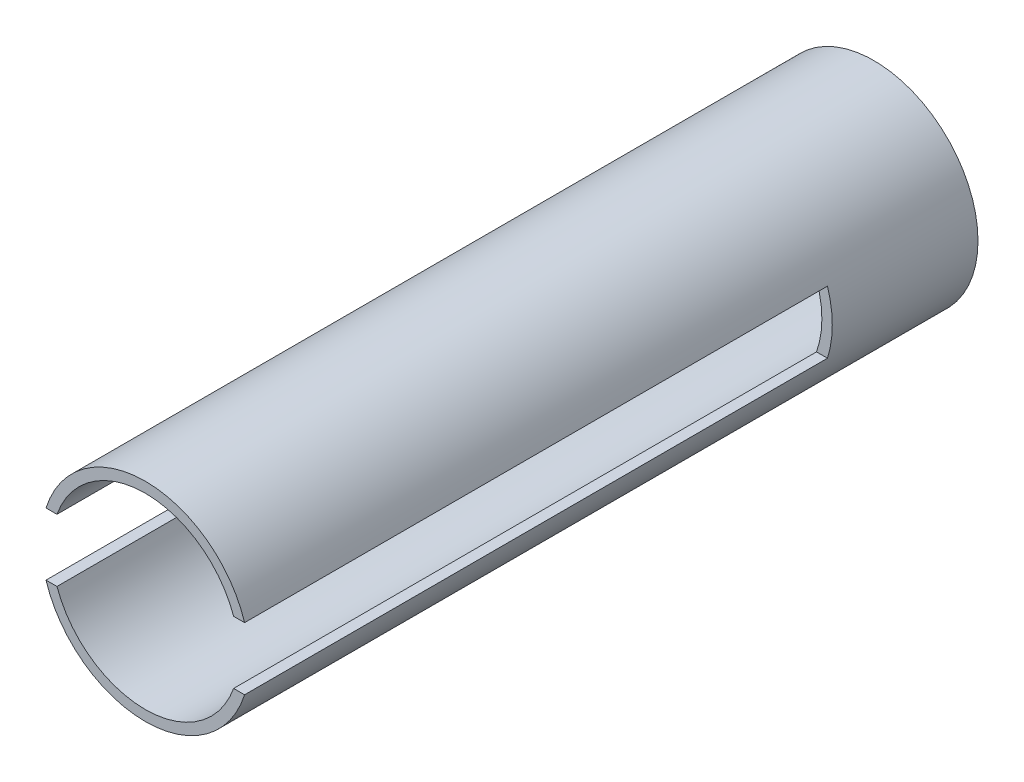
from build123d import *
from build123d.topology import SkipClean

# Parameters (mm, degrees)
BOSS_EXTRUDE1_DEPTH   = 177.8
BOSS_EXTRUDE1_2_DEPTH = 177.8
SKETCH2_R             = 63.5
SKETCH2_R_2           = 57.15
BOSS_EXTRUDE2_DEPTH   = 88.9


with BuildPart() as part:
    # Sketch1 → Boss-Extrude1 (new, symmetric)
    with BuildSketch(Plane.XY):
        with BuildLine():
            Line((-53.881536726, -19.05), (-60.57513929, -19.05))
            ThreePointArc((-60.57513929, -19.05), (0, -63.5), (60.57513929, -19.05))
            Line((60.57513929, -19.05), (53.881536726, -19.05))
            ThreePointArc((53.881536726, -19.05), (0, -57.15), (-53.881536726, -19.05))
        make_face()
    extrude(amount=BOSS_EXTRUDE1_DEPTH, both=True)



with BuildPart() as body_2:
    # Sketch1 → Boss-Extrude1 2 (new, symmetric)
    with BuildSketch(Plane.XY):
        with BuildLine():
            ThreePointArc((60.57513929, 19.05), (0, 63.5), (-60.57513929, 19.05))
            Line((-60.57513929, 19.05), (-53.881536726, 19.05))
            ThreePointArc((-53.881536726, 19.05), (0, 57.15), (53.881536726, 19.05))
            Line((53.881536726, 19.05), (60.57513929, 19.05))
        make_face()
    extrude(amount=BOSS_EXTRUDE1_2_DEPTH, both=True)


with BuildPart() as part_1:
    with SkipClean():  # the faces are left unmerged after this step: merging them gives an invalid solid
        add(part.part)

        add(body_2.part)  # Boss-Extrude2 merges body 2
        # Sketch2 → Boss-Extrude2 (add)
        with BuildSketch(Plane(origin=(0, 0, -177.8), x_dir=(-1, 0, 0), z_dir=(0, 0, -1))):
            Circle(SKETCH2_R)
            Circle(SKETCH2_R_2, mode=Mode.SUBTRACT)
        extrude(amount=BOSS_EXTRUDE2_DEPTH)


solid = part_1.part
